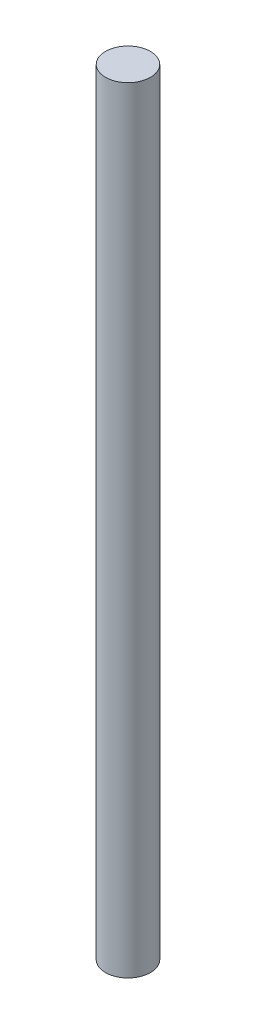
from build123d import *

# Parameters (mm, degrees)
SKETCH_1_R      = 1
EXTRUDE_1_DEPTH = 34.5


with BuildPart() as part:
    # 草图1 → 凸台-拉伸1 (new body)
    with BuildSketch(Plane(origin=(0, 0, 0), x_dir=(1, 0, 0), z_dir=(0, 1, 0))):
        Circle(SKETCH_1_R)
    extrude(amount=EXTRUDE_1_DEPTH)


solid = part.part
